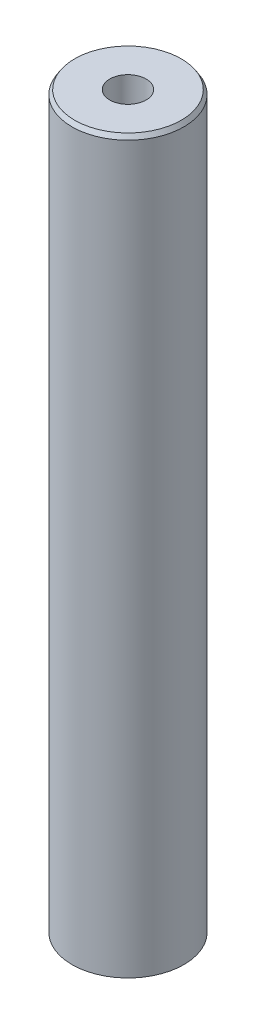
from build123d import *
from OCP.BRepFilletAPI import BRepFilletAPI_MakeChamfer

# Parameters (mm, degrees)
SKETCH1_R           = 35
BOSS_EXTRUDE1_DEPTH = 457.979607842
SKETCH2_R           = 11.38164359
CUT_EXTRUDE1_DEPTH  = 461.646633765
CHAMFER1_SIZE       = 2.722900695
CHAMFER1_SIZE2      = 1.690809764


with BuildPart() as part:
    # Sketch1 → Boss-Extrude1 (new body)
    with BuildSketch(Plane(origin=(0, 0, 0), x_dir=(1, 0, 0), z_dir=(0, 1, 0))):
        Circle(SKETCH1_R)
    extrude(amount=BOSS_EXTRUDE1_DEPTH)

    # Sketch2 → Cut-Extrude1 (cut, through all)
    with BuildSketch(Plane(origin=(0, 0, 0), x_dir=(1, 0, 0), z_dir=(0, 1, 0))):
        Circle(SKETCH2_R)
    extrude(amount=CUT_EXTRUDE1_DEPTH, mode=Mode.SUBTRACT)

    # Chamfer1: one chamfer whose edges measure the first distance from different faces: ONE call of the kernel's chamfer builder (chamfer() names one face for all edges)
    chamfer1_edges_1 = [part.edges().sort_by_distance(p)[0] for p in [
        (-35, 457.979607842, 0),
    ]]
    chamfer1_side_1 = [part.faces().sort_by_distance(p)[0] for p in [
        (-35, 228.989803921, 0),
    ]]
    chamfer1_edges_2 = [part.edges().sort_by_distance(p)[0] for p in [
        (-35, 0, 0),
    ]]
    chamfer1_side_2 = [part.faces().sort_by_distance(p)[0] for p in [
        (-34.010050506, 0, 0),
    ]]
    chamfer1 = BRepFilletAPI_MakeChamfer(part.part.solid().wrapped)
    for e in chamfer1_edges_1:
        chamfer1.Add(CHAMFER1_SIZE, CHAMFER1_SIZE2, e.wrapped, chamfer1_side_1[0].wrapped)  # the first distance lies on this face
    for e in chamfer1_edges_2:
        chamfer1.Add(CHAMFER1_SIZE, CHAMFER1_SIZE2, e.wrapped, chamfer1_side_2[0].wrapped)  # the first distance lies on this face
    add(Compound.cast(chamfer1.Shape()), mode=Mode.REPLACE)


solid = part.part
